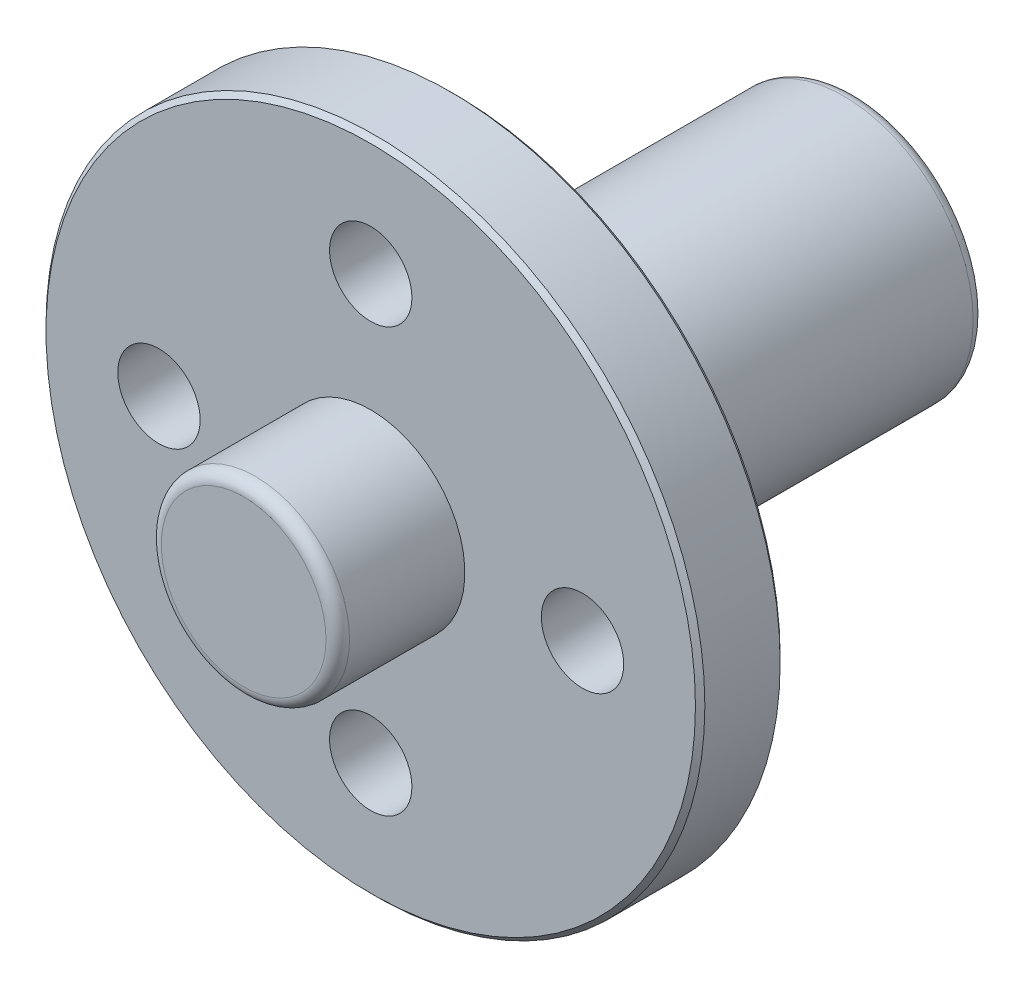
from build123d import *

# Parameters (mm, degrees)
SKETCH1_R           = 14
BOSS_EXTRUDE1_DEPTH = 3.6
SKETCH2_R           = 4
BOSS_EXTRUDE2_DEPTH = 5.4
SKETCH3_R           = 5.5
BOSS_EXTRUDE3_DEPTH = 17
SKETCH4_R           = 3.5
CUT_EXTRUDE1_DEPTH  = 17
SKETCH5_R           = 1.75
CUT_EXTRUDE2_DEPTH  = 27.095976701
CIRPATTERN1_COUNT   = 4
SKETCH6_R           = 1.75
CUT_EXTRUDE3_DEPTH  = 27.095976701
FILLET1_R           = 0.5
FILLET2_SIZE        = 0.2


with BuildPart() as part:
    # Sketch1 → Boss-Extrude1 (new body)
    with BuildSketch(Plane.XY):
        Circle(SKETCH1_R)
    extrude(amount=BOSS_EXTRUDE1_DEPTH)

    # Sketch2 → Boss-Extrude2 (add)
    with BuildSketch(Plane.XY.offset(3.6)):
        Circle(SKETCH2_R)
    extrude(amount=BOSS_EXTRUDE2_DEPTH)

    # Sketch3 → Boss-Extrude3 (add)
    with BuildSketch(Plane(origin=(0, 0, 0), x_dir=(-1, 0, 0), z_dir=(0, 0, -1))):
        Circle(SKETCH3_R)
    extrude(amount=BOSS_EXTRUDE3_DEPTH)

    # Sketch4 → Cut-Extrude1 (cut)
    with BuildSketch(Plane(origin=(0, 0, -17), x_dir=(-1, 0, 0), z_dir=(0, 0, -1))):
        Circle(SKETCH4_R)
    extrude(amount=-CUT_EXTRUDE1_DEPTH, mode=Mode.SUBTRACT)

    # Sketch5 → Cut-Extrude2 (cut, through all)
    with BuildSketch(Plane(origin=(0, 0, 0), x_dir=(-1, 0, 0), z_dir=(0, 0, -1))):
        with Locations((0, 9)):
            Circle(SKETCH5_R)
    cut_extrude2 = extrude(amount=-CUT_EXTRUDE2_DEPTH, mode=Mode.SUBTRACT)

    # CirPattern1: Cut-Extrude2 ×4 about axis
    cirpattern1_axis = Axis((0, 0, 0), (0, 0, -1))
    for i in range(1, CIRPATTERN1_COUNT):
        add(cut_extrude2.rotate(cirpattern1_axis, i * 360 / CIRPATTERN1_COUNT), mode=Mode.SUBTRACT)

    # Sketch6 → Cut-Extrude3 (cut, through all)
    with BuildSketch(Plane(origin=(0, 0, 0), x_dir=(1, 0, 0), z_dir=(0, 1, 0))):
        with Locations((0, 11)):
            Circle(SKETCH6_R)
    extrude(amount=-CUT_EXTRUDE3_DEPTH, mode=Mode.SUBTRACT)

    # Fillet1
    fillet1_edges = [part.edges().sort_by_distance(p)[0] for p in [
        (5.5, 0, -17),
        (-4, 0, 9),
    ]]
    fillet(fillet1_edges, radius=FILLET1_R)

    # Fillet2
    fillet2_edges = [part.edges().sort_by_distance(p)[0] for p in [
        (-14, 0, 0),
        (-14, 0, 3.6),
    ]]
    chamfer(fillet2_edges, length=FILLET2_SIZE)


solid = part.part
